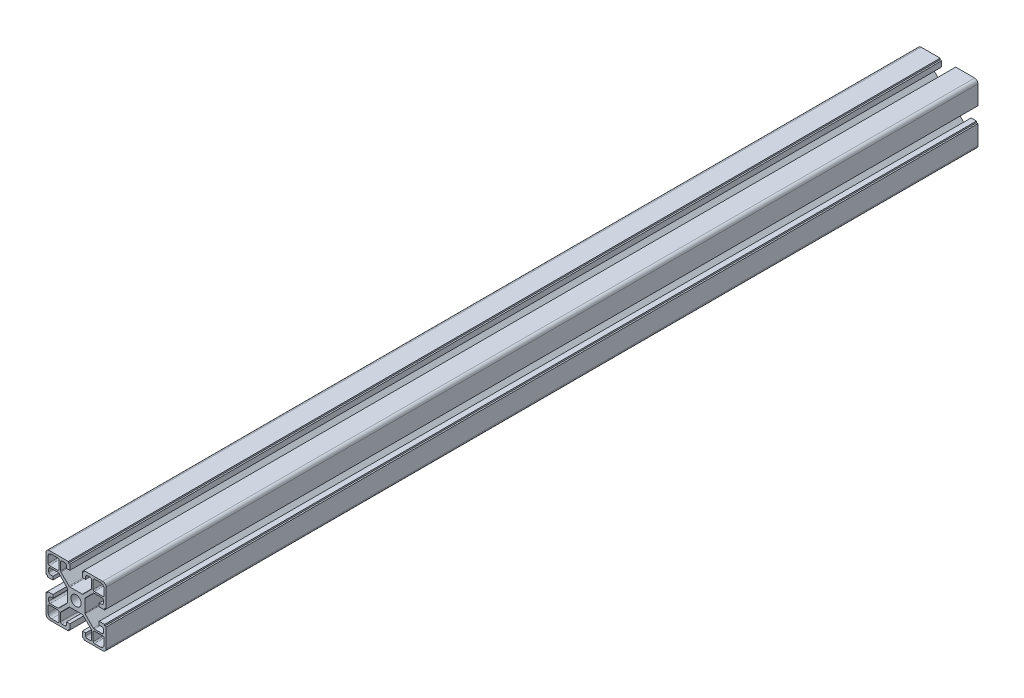
from build123d import *

# Parameters (mm, degrees)
SKETCH1_R           = 3.4
BOSS_EXTRUDE1_DEPTH = 713
SKETCH2_W           = 40
SKETCH2_H           = 133
CUT_EXTRUDE1_DEPTH  = 715.401147815


with BuildPart() as part:
    # Sketch1 → Boss-Extrude1 (new body)
    with BuildSketch(Plane.XY):
        with BuildLine():
            Line((20, 17.75), (20, 5.15))
            Line((20, 5.15), (19, 5.15))
            Line((19, 5.15), (19, 4.15))
            Line((19, 4.15), (15.4, 4.15))
            Line((15.4, 4.15), (15.4, 6.35))
            Line((15.4, 6.35), (16.95, 6.35))
            ThreePointArc((16.95, 6.35), (17.833883476, 6.716116524), (18.2, 7.6))
            Line((18.2, 7.6), (18.2, 9.3))
            ThreePointArc((18.2, 9.3), (17.907106781, 10.007106781), (17.2, 10.3))
            Line((17.2, 10.3), (12.03669957, 10.3))
            ThreePointArc((12.03669957, 10.3), (11.73040037, 10.239040459), (11.470780817, 10.065452001))
            Line((11.470780817, 10.065452001), (6.084081247, 4.674305984))
            ThreePointArc((6.084081247, 4.674305984), (5.910833239, 4.414848262), (5.85, 4.108853983))
            Line((5.85, 4.108853983), (5.85, -4.108853983))
            ThreePointArc((5.85, -4.108853983), (5.910833239, -4.414848262), (6.084081247, -4.674305984))
            Line((6.084081247, -4.674305984), (11.470780817, -10.065452001))
            ThreePointArc((11.470780817, -10.065452001), (11.73040037, -10.239040459), (12.03669957, -10.3))
            Line((12.03669957, -10.3), (17.2, -10.3))
            ThreePointArc((17.2, -10.3), (17.907106781, -10.007106781), (18.2, -9.3))
            Line((18.2, -9.3), (18.2, -7.6))
            ThreePointArc((18.2, -7.6), (17.833883476, -6.716116524), (16.95, -6.35))
            Line((16.95, -6.35), (15.4, -6.35))
            Line((15.4, -6.35), (15.4, -4.15))
            Line((15.4, -4.15), (19, -4.15))
            Line((19, -4.15), (19, -5.15))
            Line((19, -5.15), (20, -5.15))
            Line((20, -5.15), (20, -17.75))
            ThreePointArc((20, -17.75), (19.340990258, -19.340990258), (17.75, -20))
            Line((17.75, -20), (5.15, -20))
            Line((5.15, -20), (5.15, -19))
            Line((5.15, -19), (4.15, -19))
            Line((4.15, -19), (4.15, -15.4))
            Line((4.15, -15.4), (6.35, -15.4))
            Line((6.35, -15.4), (6.35, -16.95))
            ThreePointArc((6.35, -16.95), (6.716116524, -17.833883476), (7.6, -18.2))
            Line((7.6, -18.2), (9.3, -18.2))
            ThreePointArc((9.3, -18.2), (10.007106781, -17.907106781), (10.3, -17.2))
            Line((10.3, -17.2), (10.3, -12.054477022))
            ThreePointArc((10.3, -12.054477022), (10.239166761, -11.748482743), (10.065918753, -11.489025021))
            Line((10.065918753, -11.489025021), (4.665899173, -6.084547999))
            ThreePointArc((4.665899173, -6.084547999), (4.406279619, -5.910959541), (4.09998042, -5.85))
            Line((4.09998042, -5.85), (-4.09998042, -5.85))
            ThreePointArc((-4.09998042, -5.85), (-4.406279619, -5.910959541), (-4.665899173, -6.084547999))
            Line((-4.665899173, -6.084547999), (-10.065918753, -11.489025021))
            ThreePointArc((-10.065918753, -11.489025021), (-10.239166761, -11.748482743), (-10.3, -12.054477022))
            Line((-10.3, -12.054477022), (-10.3, -17.2))
            ThreePointArc((-10.3, -17.2), (-10.007106781, -17.907106781), (-9.3, -18.2))
            Line((-9.3, -18.2), (-7.6, -18.2))
            ThreePointArc((-7.6, -18.2), (-6.716116524, -17.833883476), (-6.35, -16.95))
            Line((-6.35, -16.95), (-6.35, -15.4))
            Line((-6.35, -15.4), (-4.15, -15.4))
            Line((-4.15, -15.4), (-4.15, -19))
            Line((-4.15, -19), (-5.15, -19))
            Line((-5.15, -19), (-5.15, -20))
            Line((-5.15, -20), (-17.75, -20))
            ThreePointArc((-17.75, -20), (-19.340990258, -19.340990258), (-20, -17.75))
            Line((-20, -17.75), (-20, -5.15))
            Line((-20, -5.15), (-19, -5.15))
            Line((-19, -5.15), (-19, -4.15))
            Line((-19, -4.15), (-15.4, -4.15))
            Line((-15.4, -4.15), (-15.4, -6.35))
            Line((-15.4, -6.35), (-16.95, -6.35))
            ThreePointArc((-16.95, -6.35), (-17.833883476, -6.716116524), (-18.2, -7.6))
            Line((-18.2, -7.6), (-18.2, -9.3))
            ThreePointArc((-18.2, -9.3), (-17.907106781, -10.007106781), (-17.2, -10.3))
            Line((-17.2, -10.3), (-12.03669957, -10.3))
            ThreePointArc((-12.03669957, -10.3), (-11.73040037, -10.239040459), (-11.470780817, -10.065452001))
            Line((-11.470780817, -10.065452001), (-6.084081247, -4.674305984))
            ThreePointArc((-6.084081247, -4.674305984), (-5.910833239, -4.414848262), (-5.85, -4.108853983))
            Line((-5.85, -4.108853983), (-5.85, 4.108853983))
            ThreePointArc((-5.85, 4.108853983), (-5.910833239, 4.414848262), (-6.084081247, 4.674305984))
            Line((-6.084081247, 4.674305984), (-11.470780817, 10.065452001))
            ThreePointArc((-11.470780817, 10.065452001), (-11.73040037, 10.239040459), (-12.03669957, 10.3))
            Line((-12.03669957, 10.3), (-17.2, 10.3))
            ThreePointArc((-17.2, 10.3), (-17.907106781, 10.007106781), (-18.2, 9.3))
            Line((-18.2, 9.3), (-18.2, 7.6))
            ThreePointArc((-18.2, 7.6), (-17.833883476, 6.716116524), (-16.95, 6.35))
            Line((-16.95, 6.35), (-15.4, 6.35))
            Line((-15.4, 6.35), (-15.4, 4.15))
            Line((-15.4, 4.15), (-19, 4.15))
            Line((-19, 4.15), (-19, 5.15))
            Line((-19, 5.15), (-20, 5.15))
            Line((-20, 5.15), (-20, 17.75))
            ThreePointArc((-20, 17.75), (-19.340990258, 19.340990258), (-17.75, 20))
            Line((-17.75, 20), (-5.15, 20))
            Line((-5.15, 20), (-5.15, 19))
            Line((-5.15, 19), (-4.15, 19))
            Line((-4.15, 19), (-4.15, 15.4))
            Line((-4.15, 15.4), (-6.35, 15.4))
            Line((-6.35, 15.4), (-6.35, 16.95))
            ThreePointArc((-6.35, 16.95), (-6.716116524, 17.833883476), (-7.6, 18.2))
            Line((-7.6, 18.2), (-9.3, 18.2))
            ThreePointArc((-9.3, 18.2), (-10.007106781, 17.907106781), (-10.3, 17.2))
            Line((-10.3, 17.2), (-10.3, 12.054477022))
            ThreePointArc((-10.3, 12.054477022), (-10.239166761, 11.748482743), (-10.065918753, 11.489025021))
            Line((-10.065918753, 11.489025021), (-4.665899173, 6.084547999))
            ThreePointArc((-4.665899173, 6.084547999), (-4.406279619, 5.910959541), (-4.09998042, 5.85))
            Line((-4.09998042, 5.85), (4.09998042, 5.85))
            ThreePointArc((4.09998042, 5.85), (4.406279619, 5.910959541), (4.665899173, 6.084547999))
            Line((4.665899173, 6.084547999), (10.065918753, 11.489025021))
            ThreePointArc((10.065918753, 11.489025021), (10.239166761, 11.748482743), (10.3, 12.054477022))
            Line((10.3, 12.054477022), (10.3, 17.2))
            ThreePointArc((10.3, 17.2), (10.007106781, 17.907106781), (9.3, 18.2))
            Line((9.3, 18.2), (7.6, 18.2))
            ThreePointArc((7.6, 18.2), (6.716116524, 17.833883476), (6.35, 16.95))
            Line((6.35, 16.95), (6.35, 15.4))
            Line((6.35, 15.4), (4.15, 15.4))
            Line((4.15, 15.4), (4.15, 19))
            Line((4.15, 19), (5.15, 19))
            Line((5.15, 19), (5.15, 20))
            Line((5.15, 20), (17.75, 20))
            ThreePointArc((17.75, 20), (19.340990258, 19.340990258), (20, 17.75))
        make_face()
        Circle(SKETCH1_R, mode=Mode.SUBTRACT)
        with BuildLine():
            Line((18.6, 16.35), (18.6, 12.2))
            ThreePointArc((18.6, 12.2), (18.365685425, 11.634314575), (17.8, 11.4))
            Line((17.8, 11.4), (12.2, 11.4))
            ThreePointArc((12.2, 11.4), (11.634314575, 11.634314575), (11.4, 12.2))
            Line((11.4, 12.2), (11.4, 17.8))
            ThreePointArc((11.4, 17.8), (11.634314575, 18.365685425), (12.2, 18.6))
            Line((12.2, 18.6), (16.35, 18.6))
            ThreePointArc((16.35, 18.6), (17.940990258, 17.940990258), (18.6, 16.35))
        make_face(mode=Mode.SUBTRACT)
        with BuildLine():
            Line((-12.2, 18.6), (-16.35, 18.6))
            ThreePointArc((-16.35, 18.6), (-17.940990258, 17.940990258), (-18.6, 16.35))
            Line((-18.6, 16.35), (-18.6, 12.2))
            ThreePointArc((-18.6, 12.2), (-18.365685425, 11.634314575), (-17.8, 11.4))
            Line((-17.8, 11.4), (-12.2, 11.4))
            ThreePointArc((-12.2, 11.4), (-11.634314575, 11.634314575), (-11.4, 12.2))
            Line((-11.4, 12.2), (-11.4, 17.8))
            ThreePointArc((-11.4, 17.8), (-11.634314575, 18.365685425), (-12.2, 18.6))
        make_face(mode=Mode.SUBTRACT)
        with BuildLine():
            Line((-18.6, -16.35), (-18.6, -12.2))
            ThreePointArc((-18.6, -12.2), (-18.365685425, -11.634314575), (-17.8, -11.4))
            Line((-17.8, -11.4), (-12.2, -11.4))
            ThreePointArc((-12.2, -11.4), (-11.634314575, -11.634314575), (-11.4, -12.2))
            Line((-11.4, -12.2), (-11.4, -17.8))
            ThreePointArc((-11.4, -17.8), (-11.634314575, -18.365685425), (-12.2, -18.6))
            Line((-12.2, -18.6), (-16.35, -18.6))
            ThreePointArc((-16.35, -18.6), (-17.940990258, -17.940990258), (-18.6, -16.35))
        make_face(mode=Mode.SUBTRACT)
        with BuildLine():
            Line((12.2, -18.6), (16.35, -18.6))
            ThreePointArc((16.35, -18.6), (17.940990258, -17.940990258), (18.6, -16.35))
            Line((18.6, -16.35), (18.6, -12.2))
            ThreePointArc((18.6, -12.2), (18.365685425, -11.634314575), (17.8, -11.4))
            Line((17.8, -11.4), (12.2, -11.4))
            ThreePointArc((12.2, -11.4), (11.634314575, -11.634314575), (11.4, -12.2))
            Line((11.4, -12.2), (11.4, -17.8))
            ThreePointArc((11.4, -17.8), (11.634314575, -18.365685425), (12.2, -18.6))
        make_face(mode=Mode.SUBTRACT)
    extrude(amount=BOSS_EXTRUDE1_DEPTH)

    # Sketch2 → Cut-Extrude1 (cut, through all)
    with BuildSketch(Plane(origin=(0, 20, 0), x_dir=(1, 0, 0), z_dir=(0, 1, 0))):
        with Locations((0, -646.5)):
            Rectangle(SKETCH2_W, SKETCH2_H)
    extrude(amount=-CUT_EXTRUDE1_DEPTH, mode=Mode.SUBTRACT)


solid = part.part
